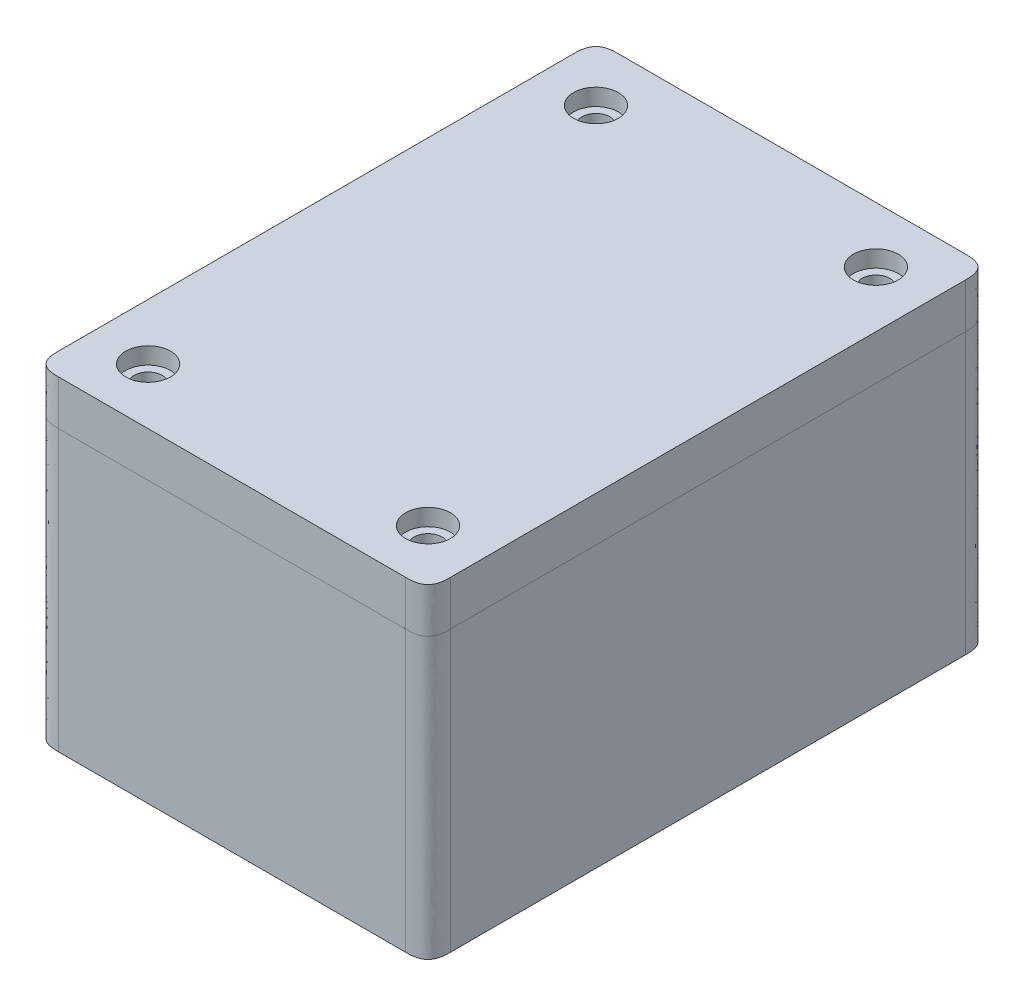
from build123d import *

# Parameters (mm, degrees)
SKETCH1_W               = 70
SKETCH1_H               = 100
BOSS_EXTRUDE1_DEPTH     = 50
SHELL1_T                = -5
BOSS_EXTRUDE2_REACH     = 133.909
SKETCH2_W               = 10
SKETCH2_H               = 10
SKETCH2_R               = 2
SKETCH2_3_R             = 2
CUT_EXTRUDE1_DEPTH      = 6
MIRROR2_COPY_1_REACH    = 133.909
MIRROR2_COPY_1_SKETCH_W = 10
MIRROR2_COPY_1_SKETCH_H = 10
MIRROR2_COPY_1_SKETCH_R = 2
MIRROR2_COPY_2_SKETCH_R = 2
MIRROR2_COPY_2_DEPTH    = 6
FILLET2_SIZE            = 4
FILLET3_SIZE            = 2
FILLET4_SIZE            = 4
SKETCH8_R               = 4
SKETCH8_R_2             = 2
BOSS_EXTRUDE6_DEPTH     = 12
LPATTERN1_COUNT         = 2
LPATTERN1_PITCH         = 40
LPATTERN1_COUNT_DIR2    = 2
LPATTERN1_PITCH_DIR2    = 30
CUT_EXTRUDE4_REACH      = 133.909
SKETCH5_R               = 5
SKETCH1_2_W             = 70
SKETCH1_2_H             = 100
BOSS_EXTRUDE4_DEPTH     = 8
SKETCH6_R               = 4
SKETCH6_R_2             = 2.5
CUT_EXTRUDE2_DEPTH      = 3
SKETCH6_3_R             = 2.5
CUT_EXTRUDE3_DEPTH      = 8
FILLET5_SIZE            = 4


with BuildPart() as part:
    # Sketch1 → Boss-Extrude1 (new body)
    with BuildSketch(Plane(origin=(0, 0, 0), x_dir=(1, 0, 0), z_dir=(0, 1, 0))):
        with Locations((35, 50)):
            Rectangle(SKETCH1_W, SKETCH1_H)
    extrude(amount=-BOSS_EXTRUDE1_DEPTH)

    # Shell1
    shell1_openings = [part.faces().sort_by_distance(p)[0] for p in [
        (35, 0, -50),
    ]]
    offset(amount=SHELL1_T, openings=shell1_openings, kind=Kind.INTERSECTION)

    # Sketch2 → Boss-Extrude2 (add, up to next)
    with BuildSketch(Plane(origin=(0, 0, 0), x_dir=(1, 0, 0), z_dir=(0, 1, 0)), mode=Mode.PRIVATE) as boss_extrude2_sk1:
        with Locations((10, 10)):
            Rectangle(SKETCH2_W, SKETCH2_H)
        with Locations((10, 10)):
            Circle(SKETCH2_R, mode=Mode.SUBTRACT)
    boss_extrude2_tool1 = extrude(boss_extrude2_sk1.sketch, amount=-BOSS_EXTRUDE2_REACH, mode=Mode.PRIVATE) - part.part
    # Sketch2 → Boss-Extrude2 (add, up to next)
    with BuildSketch(Plane(origin=(0, 0, 0), x_dir=(1, 0, 0), z_dir=(0, 1, 0)), mode=Mode.PRIVATE) as boss_extrude2_sk2:
        with Locations((10, 10)):
            Circle(SKETCH2_R)
    boss_extrude2_tool2 = extrude(boss_extrude2_sk2.sketch, amount=-BOSS_EXTRUDE2_REACH, mode=Mode.PRIVATE) - part.part
    boss_extrude2_1 = boss_extrude2_tool1.solids().sort_by_distance((10, 0, -5.141421))[0]
    add(boss_extrude2_1)
    boss_extrude2_2 = boss_extrude2_tool2.solids().sort_by_distance((10, 0, -10))[0]
    add(boss_extrude2_2)
    boss_extrude2 = boss_extrude2_1 + boss_extrude2_2  # Boss-Extrude2 as one shape, for the pattern or mirror that repeats it

    # Sketch2<3> → Cut-Extrude1 (cut)
    with BuildSketch(Plane(origin=(0, 0, 0), x_dir=(1, 0, 0), z_dir=(0, 1, 0))):
        with Locations(Location((10, 10, 0), (0, 0, 270))):
            Circle(SKETCH2_3_R)
    cut_extrude1 = extrude(amount=-CUT_EXTRUDE1_DEPTH, mode=Mode.SUBTRACT)

    # Mirror1: Boss-Extrude2, Cut-Extrude1 across plane
    add(boss_extrude2.mirror(Plane(origin=(0, 0, -50), x_dir=(1, 0, 0), z_dir=(0, 0, -1))))
    add(cut_extrude1.mirror(Plane(origin=(0, 0, -50), x_dir=(1, 0, 0), z_dir=(0, 0, -1))), mode=Mode.SUBTRACT)

    # Mirror2: Boss-Extrude2, Cut-Extrude1 across plane
    add(boss_extrude2.mirror(Plane.ZY.offset(-35)))
    add(cut_extrude1.mirror(Plane.ZY.offset(-35)), mode=Mode.SUBTRACT)

    # Mirror2 copy 1 sketch → Mirror2 copy 1 (add, up to next)
    with BuildSketch(Plane(origin=(70, 0, -100), x_dir=(-1, 0, 0), z_dir=(0, 1, 0)), mode=Mode.PRIVATE) as mirror2_copy_1_sk1:
        with Locations((10, 10)):
            Rectangle(MIRROR2_COPY_1_SKETCH_W, MIRROR2_COPY_1_SKETCH_H)
        with Locations((10, 10)):
            Circle(MIRROR2_COPY_1_SKETCH_R, mode=Mode.SUBTRACT)
    mirror2_copy_1_tool1 = extrude(mirror2_copy_1_sk1.sketch, amount=-MIRROR2_COPY_1_REACH, mode=Mode.PRIVATE) - part.part
    # Mirror2 copy 1 sketch → Mirror2 copy 1 (add, up to next)
    with BuildSketch(Plane(origin=(70, 0, -100), x_dir=(-1, 0, 0), z_dir=(0, 1, 0)), mode=Mode.PRIVATE) as mirror2_copy_1_sk2:
        with Locations((10, 10)):
            Circle(MIRROR2_COPY_1_SKETCH_R)
    mirror2_copy_1_tool2 = extrude(mirror2_copy_1_sk2.sketch, amount=-MIRROR2_COPY_1_REACH, mode=Mode.PRIVATE) - part.part
    add(mirror2_copy_1_tool1.solids().sort_by_distance((60, 0, -94.858579))[0])
    add(mirror2_copy_1_tool2.solids().sort_by_distance((60, 0, -90))[0])

    # Mirror2 copy 2 sketch → Mirror2 copy 2 (cut)
    with BuildSketch(Plane(origin=(70, 0, -100), x_dir=(-1, 0, 0), z_dir=(0, 1, 0))):
        with Locations(Location((10, 10, 0), (0, 0, 270))):
            Circle(MIRROR2_COPY_2_SKETCH_R)
    extrude(amount=-MIRROR2_COPY_2_DEPTH, mode=Mode.SUBTRACT)

    # Fillet2
    # a fillet whose section is not a circle: 4 mm, written as the material it takes off along each edge
    with BuildSketch(Plane(origin=(15, 10, -15), x_dir=(0, 0, 1), z_dir=(0, -1, 0)), Plane(origin=(15, 10, -85), x_dir=(-1, 0, 0), z_dir=(0, -1, 0))) as fillet2_piece_1:
        with BuildLine():
            add(Edge.make_bspline([(FILLET2_SIZE, 0), (FILLET2_SIZE * 0.831801948466, 0), (FILLET2_SIZE * 0.663603896932, 0), (FILLET2_SIZE * 0.292893218813, FILLET2_SIZE * 0.0716919198361), (FILLET2_SIZE * 0.0716919198361, FILLET2_SIZE * 0.292893218813), (0, FILLET2_SIZE * 0.663603896932), (0, FILLET2_SIZE * 0.831801948466), (0, FILLET2_SIZE)], knots=[0, 0, 0, 0, 0, 0, 0.5, 0.5, 1, 1, 1, 1, 1, 1], degree=5))
            Line((0, FILLET2_SIZE), (0, 0))
            Line((0, 0), (FILLET2_SIZE, 0))
        make_face()
    extrude(amount=55, mode=Mode.SUBTRACT)
    with BuildSketch(Plane(origin=(55, 10, -85), x_dir=(1, 0, 0), z_dir=(0, -1, 0)), Plane(origin=(55, 10, -15), x_dir=(0, 0, 1), z_dir=(0, -1, 0))) as fillet2_piece_2:
        with BuildLine():
            add(Edge.make_bspline([(FILLET2_SIZE, 0), (FILLET2_SIZE * 0.831801948466, 0), (FILLET2_SIZE * 0.663603896932, 0), (FILLET2_SIZE * 0.292893218813, -FILLET2_SIZE * 0.0716919198361), (FILLET2_SIZE * 0.0716919198361, -FILLET2_SIZE * 0.292893218813), (0, -FILLET2_SIZE * 0.663603896932), (0, -FILLET2_SIZE * 0.831801948466), (0, -FILLET2_SIZE)], knots=[0, 0, 0, 0, 0, 0, 0.5, 0.5, 1, 1, 1, 1, 1, 1], degree=5))
            Line((0, -FILLET2_SIZE), (0, 0))
            Line((0, 0), (FILLET2_SIZE, 0))
        make_face()
    extrude(amount=55, mode=Mode.SUBTRACT)

    # Fillet3
    # a fillet whose section is not a circle: 2 mm, written as the material it adds along each edge
    with BuildSketch(Plane(origin=(5, 0, -85), x_dir=(1, 0, 0), z_dir=(0, -1, 0)), Plane(origin=(15, 0, -95), x_dir=(1, 0, 0), z_dir=(0, -1, 0)), Plane(origin=(55, 0, -95), x_dir=(0, 0, 1), z_dir=(0, -1, 0)), Plane(origin=(65, 0, -85), x_dir=(0, 0, 1), z_dir=(0, -1, 0)), Plane(origin=(5, 0, -15), x_dir=(0, 0, -1), z_dir=(0, -1, 0)), Plane(origin=(65, 0, -15), x_dir=(-1, 0, 0), z_dir=(0, -1, 0)), Plane(origin=(55, 0, -5), x_dir=(-1, 0, 0), z_dir=(0, -1, 0))) as fillet3_piece_1:
        with BuildLine():
            add(Edge.make_bspline([(FILLET3_SIZE, 0), (FILLET3_SIZE * 0.831801948466, 0), (FILLET3_SIZE * 0.663603896932, 0), (FILLET3_SIZE * 0.292893218813, FILLET3_SIZE * 0.0716919198361), (FILLET3_SIZE * 0.0716919198361, FILLET3_SIZE * 0.292893218813), (0, FILLET3_SIZE * 0.663603896932), (0, FILLET3_SIZE * 0.831801948466), (0, FILLET3_SIZE)], knots=[0, 0, 0, 0, 0, 0, 0.5, 0.5, 1, 1, 1, 1, 1, 1], degree=5))
            Line((0, FILLET3_SIZE), (-FILLET3_SIZE * 0.02, FILLET3_SIZE))
            Line((-FILLET3_SIZE * 0.02, FILLET3_SIZE), (-FILLET3_SIZE * 0.02, -FILLET3_SIZE * 0.02))
            Line((-FILLET3_SIZE * 0.02, -FILLET3_SIZE * 0.02), (FILLET3_SIZE, -FILLET3_SIZE * 0.02))
            Line((FILLET3_SIZE, -FILLET3_SIZE * 0.02), (FILLET3_SIZE, 0))
        make_face()
    extrude(amount=45)
    with BuildSketch(Plane(origin=(15, 0, -5), x_dir=(1, 0, 0), z_dir=(0, -1, 0))) as fillet3_piece_2:
        with BuildLine():
            add(Edge.make_bspline([(FILLET3_SIZE, 0), (FILLET3_SIZE * 0.831801948466, 0), (FILLET3_SIZE * 0.663603896932, 0), (FILLET3_SIZE * 0.292893218813, -FILLET3_SIZE * 0.0716919198361), (FILLET3_SIZE * 0.0716919198361, -FILLET3_SIZE * 0.292893218813), (0, -FILLET3_SIZE * 0.663603896932), (0, -FILLET3_SIZE * 0.831801948466), (0, -FILLET3_SIZE)], knots=[0, 0, 0, 0, 0, 0, 0.5, 0.5, 1, 1, 1, 1, 1, 1], degree=5))
            Line((0, -FILLET3_SIZE), (-FILLET3_SIZE * 0.02, -FILLET3_SIZE))
            Line((-FILLET3_SIZE * 0.02, -FILLET3_SIZE), (-FILLET3_SIZE * 0.02, FILLET3_SIZE * 0.02))
            Line((-FILLET3_SIZE * 0.02, FILLET3_SIZE * 0.02), (FILLET3_SIZE, FILLET3_SIZE * 0.02))
            Line((FILLET3_SIZE, FILLET3_SIZE * 0.02), (FILLET3_SIZE, 0))
        make_face()
    extrude(amount=45)

    # Fillet4
    # a fillet whose section is not a circle: 4 mm, written as the material it takes off along each edge
    with BuildSketch(Plane(origin=(0, 10, 0), x_dir=(1, 0, 0), z_dir=(0, -1, 0)), Plane(origin=(0, 10, -100), x_dir=(0, 0, 1), z_dir=(0, -1, 0))) as fillet4_piece_1:
        with BuildLine():
            add(Edge.make_bspline([(FILLET4_SIZE, 0), (FILLET4_SIZE * 0.831801948466, 0), (FILLET4_SIZE * 0.663603896932, 0), (FILLET4_SIZE * 0.292893218813, -FILLET4_SIZE * 0.0716919198361), (FILLET4_SIZE * 0.0716919198361, -FILLET4_SIZE * 0.292893218813), (0, -FILLET4_SIZE * 0.663603896932), (0, -FILLET4_SIZE * 0.831801948466), (0, -FILLET4_SIZE)], knots=[0, 0, 0, 0, 0, 0, 0.5, 0.5, 1, 1, 1, 1, 1, 1], degree=5))
            Line((0, -FILLET4_SIZE), (0, 0))
            Line((0, 0), (FILLET4_SIZE, 0))
        make_face()
    extrude(amount=70, mode=Mode.SUBTRACT)
    with BuildSketch(Plane(origin=(70, 10, -100), x_dir=(0, 0, 1), z_dir=(0, -1, 0)), Plane(origin=(70, 10, 0), x_dir=(-1, 0, 0), z_dir=(0, -1, 0))) as fillet4_piece_2:
        with BuildLine():
            add(Edge.make_bspline([(FILLET4_SIZE, 0), (FILLET4_SIZE * 0.831801948466, 0), (FILLET4_SIZE * 0.663603896932, 0), (FILLET4_SIZE * 0.292893218813, FILLET4_SIZE * 0.0716919198361), (FILLET4_SIZE * 0.0716919198361, FILLET4_SIZE * 0.292893218813), (0, FILLET4_SIZE * 0.663603896932), (0, FILLET4_SIZE * 0.831801948466), (0, FILLET4_SIZE)], knots=[0, 0, 0, 0, 0, 0, 0.5, 0.5, 1, 1, 1, 1, 1, 1], degree=5))
            Line((0, FILLET4_SIZE), (0, 0))
            Line((0, 0), (FILLET4_SIZE, 0))
        make_face()
    extrude(amount=70, mode=Mode.SUBTRACT)

    # Sketch8 → Boss-Extrude6 (add)
    with BuildSketch(Plane(origin=(0, -45, 0), x_dir=(1, 0, 0), z_dir=(0, 1, 0))):
        with Locations(Location((20, 30, 0), (0, 0, 90))):
            Circle(SKETCH8_R)
        with Locations(Location((20, 30, 0), (0, 0, 270))):
            Circle(SKETCH8_R_2, mode=Mode.SUBTRACT)
    boss_extrude6 = extrude(amount=BOSS_EXTRUDE6_DEPTH)

    # LPattern1: Boss-Extrude6 2 × 2
    with Locations(*[(j * LPATTERN1_PITCH_DIR2, 0, -i * LPATTERN1_PITCH) for i in range(LPATTERN1_COUNT) for j in range(LPATTERN1_COUNT_DIR2) if (i, j) != (0, 0)]):
        add(boss_extrude6)

    # Sketch5 → Cut-Extrude4 (cut, up to next)
    with BuildSketch(Plane(origin=(0, 0, -100), x_dir=(-1, 0, 0), z_dir=(0, 0, -1)), mode=Mode.PRIVATE) as cut_extrude4_sk1:
        with Locations((-35, -25)):
            Circle(SKETCH5_R)
    cut_extrude4_tool1 = extrude(cut_extrude4_sk1.sketch, amount=-CUT_EXTRUDE4_REACH, mode=Mode.PRIVATE) & part.part
    add(cut_extrude4_tool1.solids().sort_by_distance((35, -25, -100))[0], mode=Mode.SUBTRACT)


with BuildPart() as body_2:
    # Sketch1<2> → Boss-Extrude4 (new body)
    with BuildSketch(Plane(origin=(0, 0, 0), x_dir=(1, 0, 0), z_dir=(0, 1, 0))):
        with Locations((35, 50)):
            Rectangle(SKETCH1_2_W, SKETCH1_2_H)
    extrude(amount=BOSS_EXTRUDE4_DEPTH)

    # Sketch6 → Cut-Extrude2 (cut)
    # profile 1 of 4: a face of its own
    with BuildSketch(Plane(origin=(0, 8, 0), x_dir=(1, 0, 0), z_dir=(0, 1, 0))):
        with Locations(Location((10, 90, 0), (0, 0, 270))):
            Circle(SKETCH6_R)
        with Locations(Location((10, 90, 0), (0, 0, 270))):
            Circle(SKETCH6_R_2, mode=Mode.SUBTRACT)
    # profile 2 of 4: a face of its own
    with BuildSketch(Plane(origin=(0, 8, 0), x_dir=(1, 0, 0), z_dir=(0, 1, 0))):
        with Locations(Location((60, 90, 0), (0, 0, 270))):
            Circle(SKETCH6_R)
        with Locations(Location((60, 90, 0), (0, 0, 270))):
            Circle(SKETCH6_R_2, mode=Mode.SUBTRACT)
    # profile 3 of 4: a face of its own
    with BuildSketch(Plane(origin=(0, 8, 0), x_dir=(1, 0, 0), z_dir=(0, 1, 0))):
        with Locations(Location((60, 10, 0), (0, 0, 270))):
            Circle(SKETCH6_R)
        with Locations(Location((60, 10, 0), (0, 0, 270))):
            Circle(SKETCH6_R_2, mode=Mode.SUBTRACT)
    # profile 4 of 4: a face of its own
    with BuildSketch(Plane(origin=(0, 8, 0), x_dir=(1, 0, 0), z_dir=(0, 1, 0))):
        with Locations(Location((10, 10, 0), (0, 0, 270))):
            Circle(SKETCH6_R)
        with Locations(Location((10, 10, 0), (0, 0, 270))):
            Circle(SKETCH6_R_2, mode=Mode.SUBTRACT)
    extrude(amount=-CUT_EXTRUDE2_DEPTH, mode=Mode.SUBTRACT)

    # Sketch6<3> → Cut-Extrude3 (cut)
    with BuildSketch(Plane(origin=(0, 8, 0), x_dir=(1, 0, 0), z_dir=(0, 1, 0))):
        with Locations(Location((10, 90, 0), (0, 0, 270))):
            Circle(SKETCH6_3_R)
        with Locations(Location((60, 90, 0), (0, 0, 270))):
            Circle(SKETCH6_3_R)
        with Locations(Location((10, 10, 0), (0, 0, 270))):
            Circle(SKETCH6_3_R)
        with Locations(Location((60, 10, 0), (0, 0, 270))):
            Circle(SKETCH6_3_R)
    extrude(amount=-CUT_EXTRUDE3_DEPTH, mode=Mode.SUBTRACT)

    # Fillet5
    # a fillet whose section is not a circle: 4 mm, written as the material it takes off along each edge
    with BuildSketch(Plane(origin=(70, -10, -100), x_dir=(0, 0, 1), z_dir=(0, 1, 0)), Plane(origin=(70, -10, 0), x_dir=(-1, 0, 0), z_dir=(0, 1, 0))) as fillet5_piece_1:
        with BuildLine():
            add(Edge.make_bspline([(FILLET5_SIZE, 0), (FILLET5_SIZE * 0.831801948466, 0), (FILLET5_SIZE * 0.663603896932, 0), (FILLET5_SIZE * 0.292893218813, -FILLET5_SIZE * 0.0716919198361), (FILLET5_SIZE * 0.0716919198361, -FILLET5_SIZE * 0.292893218813), (0, -FILLET5_SIZE * 0.663603896932), (0, -FILLET5_SIZE * 0.831801948466), (0, -FILLET5_SIZE)], knots=[0, 0, 0, 0, 0, 0, 0.5, 0.5, 1, 1, 1, 1, 1, 1], degree=5))
            Line((0, -FILLET5_SIZE), (0, 0))
            Line((0, 0), (FILLET5_SIZE, 0))
        make_face()
    extrude(amount=28, mode=Mode.SUBTRACT)
    with BuildSketch(Plane(origin=(0, -10, 0), x_dir=(1, 0, 0), z_dir=(0, 1, 0)), Plane(origin=(0, -10, -100), x_dir=(0, 0, 1), z_dir=(0, 1, 0))) as fillet5_piece_2:
        with BuildLine():
            add(Edge.make_bspline([(FILLET5_SIZE, 0), (FILLET5_SIZE * 0.831801948466, 0), (FILLET5_SIZE * 0.663603896932, 0), (FILLET5_SIZE * 0.292893218813, FILLET5_SIZE * 0.0716919198361), (FILLET5_SIZE * 0.0716919198361, FILLET5_SIZE * 0.292893218813), (0, FILLET5_SIZE * 0.663603896932), (0, FILLET5_SIZE * 0.831801948466), (0, FILLET5_SIZE)], knots=[0, 0, 0, 0, 0, 0, 0.5, 0.5, 1, 1, 1, 1, 1, 1], degree=5))
            Line((0, FILLET5_SIZE), (0, 0))
            Line((0, 0), (FILLET5_SIZE, 0))
        make_face()
    extrude(amount=28, mode=Mode.SUBTRACT)


solid = Compound([part.part, body_2.part])
